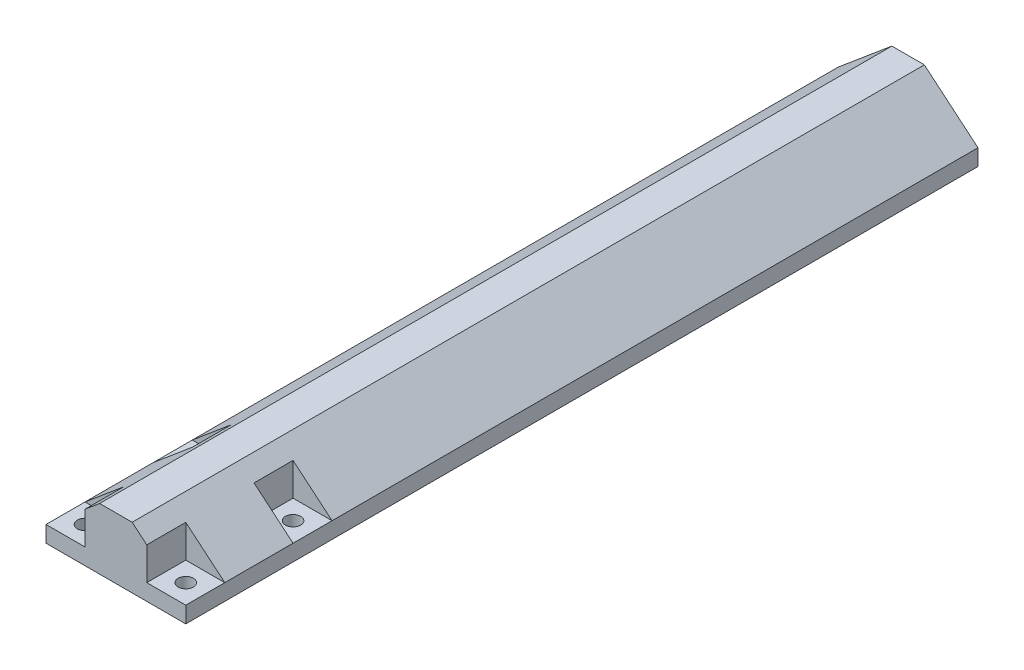
from build123d import *

# Parameters (mm, degrees)
SKETCH1_W                = 43
SKETCH1_H                = 45
BOSS_EXTRUDE1_DEPTH      = 5
BOSS_EXTRUDE2_DEPTH      = 22.5
BOSS_EXTRUDE2_DEPTH_BACK = 221.22316262
SKETCH4_W                = 43
SKETCH4_H                = 5
SKETCH5_R                = 2.35
CUT_EXTRUDE2_DEPTH       = 224.06294432
CUT_EXTRUDE3_START       = -13.845143914
CUT_EXTRUDE3_OUTLINE_W   = 12
CUT_EXTRUDE3_OUTLINE_H   = 12
CUT_EXTRUDE3_OUTLINE_R   = 2.35
CUT_EXTRUDE3_DEPTH       = 10.069195574


# Read off the part's stored shape, not the designer's step: Cut-Extrude3
with BuildPart() as part:
    # Sketch1 → Boss-Extrude1 (new body)
    with BuildSketch(Plane(origin=(0, 0, 0), x_dir=(1, 0, 0), z_dir=(0, 1, 0))):
        Rectangle(SKETCH1_W, SKETCH1_H)
    extrude(amount=BOSS_EXTRUDE1_DEPTH)

    # Sketch4 → Boss-Extrude2 (add, two sides: drawn at the far end of the back side and taken through both)
    with BuildSketch(Plane.XY.offset(-BOSS_EXTRUDE2_DEPTH_BACK)):
        Polygon((21.5, 5), (-21.5, 5), (-5, 18.845143914), (5, 18.845143914), align=None)
        with Locations((0, 2.5)):
            Rectangle(SKETCH4_W, SKETCH4_H)
    extrude(amount=BOSS_EXTRUDE2_DEPTH + BOSS_EXTRUDE2_DEPTH_BACK)

    # Sketch5 → Cut-Extrude2 (cut, through all)
    with BuildSketch(Plane.XZ):
        with Locations(Location((15.5, -16.5, 0), (0, 0, 270))):
            Circle(SKETCH5_R)
        with Locations(Location((-15.5, -16.5, 0), (0, 0, 270))):
            Circle(SKETCH5_R)
        with Locations(Location((-15.5, 16.5, 0), (0, 0, 270))):
            Circle(SKETCH5_R)
        with Locations(Location((15.5, 16.5, 0), (0, 0, 270))):
            Circle(SKETCH5_R)
    extrude(amount=-CUT_EXTRUDE2_DEPTH, mode=Mode.SUBTRACT)

    # Cut-Extrude3 outline → Cut-Extrude3 (cut)
    # profile 1 of 4: a face of its own
    with BuildSketch(Plane(origin=(0, 18.845143914, 0), x_dir=(1, 0, 0), z_dir=(0, 1, 0)).offset(CUT_EXTRUDE3_START)):
        with Locations((-15.5, 16.5)):
            Rectangle(CUT_EXTRUDE3_OUTLINE_W, CUT_EXTRUDE3_OUTLINE_H)
        with Locations((-15.5, 16.5)):
            Circle(CUT_EXTRUDE3_OUTLINE_R, mode=Mode.SUBTRACT)
    # profile 2 of 4: a face of its own
    with BuildSketch(Plane(origin=(0, 18.845143914, 0), x_dir=(1, 0, 0), z_dir=(0, 1, 0)).offset(CUT_EXTRUDE3_START)):
        with Locations((-15.5, -16.5)):
            Rectangle(CUT_EXTRUDE3_OUTLINE_W, CUT_EXTRUDE3_OUTLINE_H)
        with Locations((-15.5, -16.5)):
            Circle(CUT_EXTRUDE3_OUTLINE_R, mode=Mode.SUBTRACT)
    # profile 3 of 4: a face of its own
    with BuildSketch(Plane(origin=(0, 18.845143914, 0), x_dir=(1, 0, 0), z_dir=(0, 1, 0)).offset(CUT_EXTRUDE3_START)):
        with Locations((15.5, 16.5)):
            Rectangle(CUT_EXTRUDE3_OUTLINE_W, CUT_EXTRUDE3_OUTLINE_H)
        with Locations((15.5, 16.5)):
            Circle(CUT_EXTRUDE3_OUTLINE_R, mode=Mode.SUBTRACT)
    # profile 4 of 4: a face of its own
    with BuildSketch(Plane(origin=(0, 18.845143914, 0), x_dir=(1, 0, 0), z_dir=(0, 1, 0)).offset(CUT_EXTRUDE3_START)):
        with Locations((15.5, -16.5)):
            Rectangle(CUT_EXTRUDE3_OUTLINE_W, CUT_EXTRUDE3_OUTLINE_H)
        with Locations((15.5, -16.5)):
            Circle(CUT_EXTRUDE3_OUTLINE_R, mode=Mode.SUBTRACT)
    extrude(amount=CUT_EXTRUDE3_DEPTH, mode=Mode.SUBTRACT)


solid = part.part
